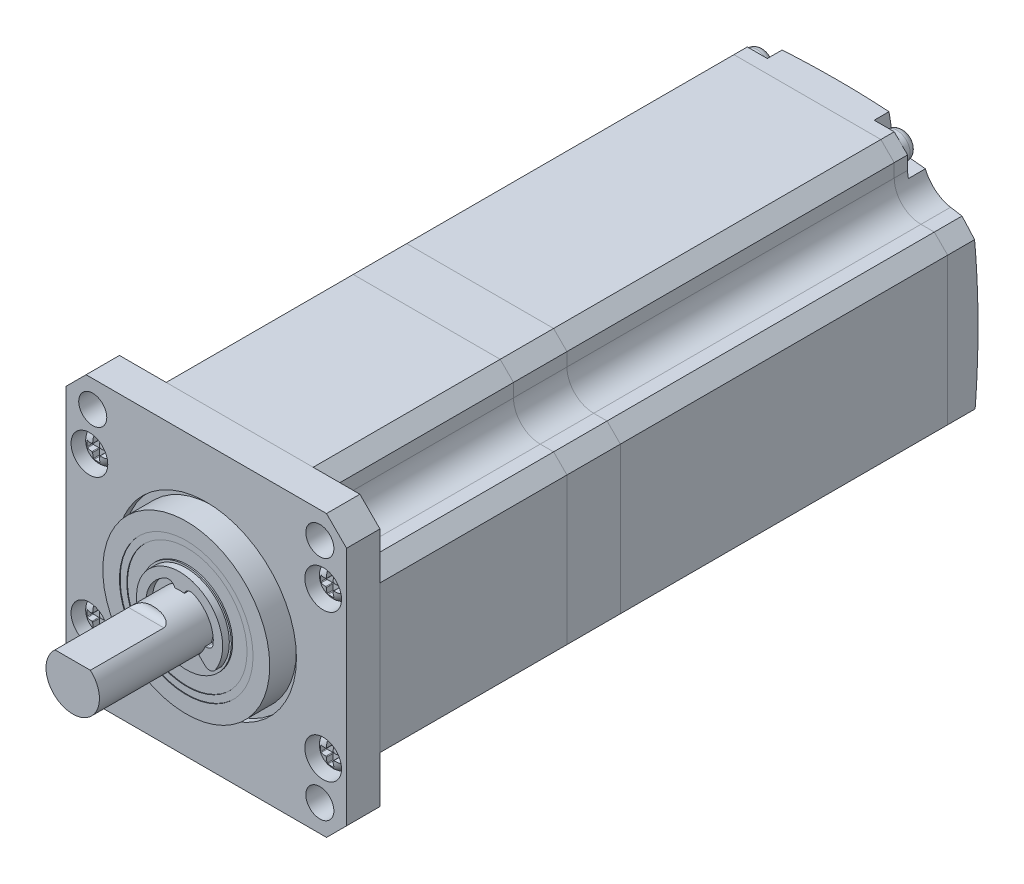
from build123d import *

# Parameters (mm, degrees)
SKETCH_1_R          = 2.1
EXTRUDE_1_DEPTH     = 5
SKETCH_2_R          = 12.5
SKETCH_2_R_2        = 4
EXTRUDE_2_DEPTH     = 3
SKETCH_2_3_R        = 4
EXTRUDE_3_DEPTH     = 20
CUT_EXTRUDE_START   = -1
SKETCH_2_4_R        = 13.5
SKETCH_2_4_R_2      = 12.5
CUT_EXTRUDE_1_DEPTH = 1
CUT_EXTRUDE_2_DEPTH = 12
FILLET_1_R          = 1
SKETCH_5_R          = 10
SKETCH_5_R_2        = 9
CUT_EXTRUDE_3_DEPTH = 0.1
SKETCH_5_4_R        = 9
SKETCH_5_4_R_2      = 6.75
CUT_EXTRUDE_4_DEPTH = 0.2
EXTRUDE_4_DEPTH     = 90
EXTRUDE_5_DEPTH     = 1
FILLET_2_R          = 1
SKETCH_8_R          = 2.75
CUT_EXTRUDE_5_DEPTH = 3
SKETCH_9_R          = 2.5
EXTRUDE_6_DEPTH     = 2
CUT_EXTRUDE_6_DEPTH = 1
FILLET_3_R          = 1.6
FILLET_4_R          = 0.1
CUT_EXTRUDE_7_DEPTH = 3
SKETCH_16_R         = 2
EXTRUDE_7_DEPTH     = 2
CUT_EXTRUDE_8_DEPTH = 1
FILLET_5_R          = 1.1


# Some blends are built 0.0001 mm under size
with BuildPart() as part:
    # 草圖1 → 填料-伸長1 (new body)
    with BuildSketch(Plane.XY):
        Polygon((39, -42), (3, -42), (0, -39), (0, -3), (3, 0), (39, 0), (42, -3), (42, -39), align=None)
        with Locations((4, -4)):
            Circle(SKETCH_1_R, mode=Mode.SUBTRACT)
        with Locations((38, -4)):
            Circle(SKETCH_1_R, mode=Mode.SUBTRACT)
        with Locations((4, -38)):
            Circle(SKETCH_1_R, mode=Mode.SUBTRACT)
        with Locations((38, -38)):
            Circle(SKETCH_1_R, mode=Mode.SUBTRACT)
    extrude(amount=EXTRUDE_1_DEPTH)

    # 草圖2 → 填料-伸長2 (add)
    # profile 1 of 2: a face of its own
    with BuildSketch(Plane.XY.offset(5)):
        with Locations((21, -21)):
            Circle(SKETCH_2_R)
        with Locations((21, -21)):
            Circle(SKETCH_2_R_2, mode=Mode.SUBTRACT)
    # profile 2 of 2: a face of its own
    with BuildSketch(Plane.XY.offset(5)):
        with Locations((21, -21)):
            Circle(SKETCH_2_R_2)
    extrude(amount=EXTRUDE_2_DEPTH)

    # 草圖2<3> → 填料-伸長3 (add)
    with BuildSketch(Plane.XY.offset(5)):
        with Locations((21, -21)):
            Circle(SKETCH_2_3_R)
    extrude(amount=EXTRUDE_3_DEPTH)

    # 草圖2<4> → 除料-伸長1 (cut)
    with BuildSketch(Plane.XY.offset(5).offset(CUT_EXTRUDE_START)):
        with Locations((21, -21)):
            Circle(SKETCH_2_4_R)
        with Locations((21, -21)):
            Circle(SKETCH_2_4_R_2, mode=Mode.SUBTRACT)
    extrude(amount=CUT_EXTRUDE_1_DEPTH, mode=Mode.SUBTRACT)

    # 草圖3 → 除料-伸長2 (cut)
    with BuildSketch(Plane.XY.offset(25)):
        Polygon((-59.028881398, -18), (18.354248689, -18), (23.645751311, -18), (101.028881398, -18), (101.028881398, 136.766260173), (-59.028881398, 136.766260173), align=None)
    extrude(amount=-CUT_EXTRUDE_2_DEPTH, mode=Mode.SUBTRACT)

    # 圓角1
    fillet_1_edges = [part.edges().sort_by_distance(p)[0] for p in [
        (21, -18, 13),
    ]]
    fillet(fillet_1_edges, radius=FILLET_1_R - 0.0001)  # a hair under: the kernel refuses the full size

    # 草圖5 → 除料-伸長3 (cut)
    with BuildSketch(Plane.XY.offset(8)):
        with Locations((21, -21)):
            Circle(SKETCH_5_R)
        with Locations((21, -21)):
            Circle(SKETCH_5_R_2, mode=Mode.SUBTRACT)
    extrude(amount=-CUT_EXTRUDE_3_DEPTH, mode=Mode.SUBTRACT)

    # 草圖5<4> → 除料-伸長4 (cut)
    with BuildSketch(Plane.XY.offset(8)):
        with Locations((21, -21)):
            Circle(SKETCH_5_4_R)
        with Locations((21, -21)):
            Circle(SKETCH_5_4_R_2, mode=Mode.SUBTRACT)
    extrude(amount=-CUT_EXTRUDE_4_DEPTH, mode=Mode.SUBTRACT)

    # 草圖6 → 填料-伸長4 (add)
    with BuildSketch(Plane(origin=(0, 0, 0), x_dir=(-1, 0, 0), z_dir=(0, 0, -1))):
        with BuildLine():
            Line((-34, -2), (-32, 0))
            Line((-32, 0), (-10, 0))
            Line((-10, 0), (-8, -2))
            Line((-8, -2), (-8, -4))
            ThreePointArc((-8, -4), (-6.828427125, -6.828427125), (-4, -8))
            Line((-4, -8), (-2, -8))
            Line((-2, -8), (0, -10))
            Line((0, -10), (0, -32))
            Line((0, -32), (-2, -34))
            Line((-2, -34), (-4, -34))
            ThreePointArc((-4, -34), (-6.828427125, -35.171572875), (-8, -38))
            Line((-8, -38), (-8, -40))
            Line((-8, -40), (-10, -42))
            Line((-10, -42), (-32, -42))
            Line((-32, -42), (-34, -40))
            Line((-34, -40), (-34, -38))
            ThreePointArc((-34, -38), (-35.171572875, -35.171572875), (-38, -34))
            Line((-38, -34), (-40, -34))
            Line((-40, -34), (-42, -32))
            Line((-42, -32), (-42, -10))
            Line((-42, -10), (-40, -8))
            Line((-40, -8), (-38, -8))
            ThreePointArc((-38, -8), (-35.171572875, -6.828427125), (-34, -4))
            Line((-34, -4), (-34, -2))
        make_face()
    extrude(amount=EXTRUDE_4_DEPTH)

    # 草圖7 → 填料-伸長5 (add)
    with BuildSketch(Plane.XY.offset(8)):
        with BuildLine():
            Line((16.439161261, -25.560838739), (18.136217536, -23.863782464))
            ThreePointArc((18.136217536, -23.863782464), (17.566814434, -23.148426603), (17.172383736, -22.323576116))
            Line((17.172383736, -22.323576116), (16.126536523, -22.323576116))
            ThreePointArc((16.126536523, -22.323576116), (16.736277028, -18.293865041), (20.123076703, -16.026720847))
            Line((20.123076703, -16.026720847), (20.29672488, -17.0115286))
            ThreePointArc((20.29672488, -17.0115286), (21, -16.95), (21.70327512, -17.0115286))
            Line((21.70327512, -17.0115286), (21.876923297, -16.026720847))
            ThreePointArc((21.876923297, -16.026720847), (25.264712589, -18.295424888), (25.872493847, -22.327141179))
            Line((25.872493847, -22.327141179), (24.826381618, -22.327141179))
            ThreePointArc((24.826381618, -22.327141179), (24.432184504, -23.150025472), (23.863782464, -23.863782464))
            Line((23.863782464, -23.863782464), (25.560838739, -25.560838739))
            ThreePointArc((25.560838739, -25.560838739), (21, -14.55), (16.439161261, -25.560838739))
        make_face()
    extrude(amount=EXTRUDE_5_DEPTH)

    # 圓角2
    # the kernel refuses this fillet: 1 mm, written as the material it adds along each edge
    with BuildSketch(Plane(origin=(20.123076703, -16.026720847, 4.882716049), x_dir=(-0.9558358766981501, -0.29390096430035584, 0), z_dir=(0, 0, 1))) as fillet_2_piece_1:
        with BuildLine():
            CenterArc((1.12345679, 0.992349949), FILLET_2_R, 180, 97.091646084)
            Line((0.12345679, 0.992349949), (0, 0))
            ThreePointArc((0, 0), (0.62345679, -0.038632758), (1.24691358, 0))
        make_face()
    extrude(amount=4.117283951)
    with BuildSketch(Plane(origin=(21.876923297, -16.026720847, 4.882716049), x_dir=(-0.1736481776669265, -0.9848077530122088, 0), z_dir=(0, 0, 1))) as fillet_2_piece_2:
        with BuildLine():
            CenterArc((1.12345679, 0.992349949), FILLET_2_R, 165.816707831, 97.091646084)
            ThreePointArc((0.153939948, 1.237374628), (0.038632758, 0.62345679), (0, 0))
            Line((0, 0), (1, 0))
        make_face()
    extrude(amount=4.117283951)
    with BuildSketch(Plane(origin=(25.872493847, -22.327141179, 5.666954924), x_dir=(0.17252595319935563, 0.9850049723085937, 0), z_dir=(0, 0, 1))) as fillet_2_piece_3:
        with BuildLine():
            CenterArc((0.840820206, 0.995722171), FILLET_2_R, 189.934715907, 85.36685138)
            Line((-0.144184767, 0.823196218), (0, 0))
            ThreePointArc((0, 0), (0.466609015, -0.021603036), (0.93321803, 0))
        make_face()
    extrude(amount=3.333045076)
    with BuildSketch(Plane(origin=(16.126536523, -22.323576116, 5.665050192), x_dir=(1, 0, 0), z_dir=(0, 0, 1))) as fillet_2_piece_4:
        with BuildLine():
            CenterArc((0.836410283, 1), FILLET_2_R, 184.582549745, 85.417450255)
            ThreePointArc((-0.160392975, 0.920104663), (-0.101513427, 0.456336355), (0, 0))
            Line((0, 0), (0.836410283, 0))
        make_face()
    extrude(amount=3.334949808)
    # the kernel refuses this fillet: 1 mm, written as the material it takes off along each edge
    with BuildSketch(Plane(origin=(25.560838739, -25.560838739, 8), x_dir=(-0.7071067811865458, 0.7071067811865491, 0), z_dir=(0, 0, 1))) as fillet_2_2_piece_1:
        with BuildLine():
            CenterArc((1.092528582, -1), FILLET_2_R, 90, 100.57288959)
            ThreePointArc((0.109506303, -1.183486239), (0.027434923, -0.594270836), (0, 0))
            Line((0, 0), (1.092528582, 0))
        make_face()
    extrude(amount=3.971354181, mode=Mode.SUBTRACT)
    with BuildSketch(Plane(origin=(16.439161261, -25.560838739, 8), x_dir=(0.707106781186541, 0.707106781186554, 0), z_dir=(0, 0, 1))) as fillet_2_2_piece_2:
        with BuildLine():
            CenterArc((1.092528582, 1), FILLET_2_R, 169.42711041, 100.57288959)
            ThreePointArc((0.109506303, 1.183486239), (0.027434923, 0.594270836), (0, 0))
            Line((0, 0), (1.092528582, 0))
        make_face()
    extrude(amount=3.971354181, mode=Mode.SUBTRACT)

    # 草圖8 → 除料-伸長5 (cut)
    with BuildSketch(Plane.XY.offset(5)):
        with Locations((3.5, -10)):
            Circle(SKETCH_8_R)
        with Locations((38.5, -10)):
            Circle(SKETCH_8_R)
        with Locations((3.5, -32)):
            Circle(SKETCH_8_R)
        with Locations((38.5, -32)):
            Circle(SKETCH_8_R)
    extrude(amount=-CUT_EXTRUDE_5_DEPTH, mode=Mode.SUBTRACT)

    # 草圖9 → 填料-伸長6 (add)
    with BuildSketch(Plane.XY.offset(2)):
        with Locations((3.5, -10)):
            Circle(SKETCH_9_R)
        with Locations(Location((38.5, -10, 0), (0, 0, 180))):
            Circle(SKETCH_9_R)
        with Locations((38.5, -32)):
            Circle(SKETCH_9_R)
        with Locations(Location((3.5, -32, 0), (0, 0, 180))):
            Circle(SKETCH_9_R)
    extrude(amount=EXTRUDE_6_DEPTH)

    # 草圖10 → 除料-伸長6 (cut)
    with BuildSketch(Plane.XY.offset(4)):
        Polygon((2, -10.5), (3, -10.5), (3, -11.5), (4, -11.5), (4, -10.5), (5, -10.5), (5, -9.5), (4, -9.5), (4, -8.5), (3, -8.5), (3, -9.5), (2, -9.5), align=None)
        Polygon((38, -9.5), (37, -9.5), (37, -10.5), (38, -10.5), (38, -11.5), (39, -11.5), (39, -10.5), (40, -10.5), (40, -9.5), (39, -9.5), (39, -8.5), (38, -8.5), align=None)
        Polygon((38, -32.5), (38, -33.5), (39, -33.5), (39, -32.5), (40, -32.5), (40, -31.5), (39, -31.5), (39, -30.5), (38, -30.5), (38, -31.5), (37, -31.5), (37, -32.5), align=None)
        Polygon((4, -32.5), (5, -32.5), (5, -31.5), (4, -31.5), (4, -30.5), (3, -30.5), (3, -31.5), (2, -31.5), (2, -32.5), (3, -32.5), (3, -33.5), (4, -33.5), align=None)
    extrude(amount=-CUT_EXTRUDE_6_DEPTH, mode=Mode.SUBTRACT)

    # 圓角3
    # the kernel refuses this fillet: 1.6 mm, written as the material it takes off along each edge
    with BuildSketch(Plane(origin=(3.5, -10, 4), x_dir=(1, 0, 0), z_dir=(0, -1, 0))) as fillet_3_piece_1:
        with BuildLine():
            CenterArc((2.5 - FILLET_3_R, -FILLET_3_R), FILLET_3_R, 0, 90)
            Line((2.5 - FILLET_3_R, 0), (2.5, 0))
            Line((2.5, 0), (2.5, -FILLET_3_R))
        make_face()
    revolve(axis=Axis((3.5, -10, 4), (0, 0, 1)), mode=Mode.SUBTRACT)
    with BuildSketch(Plane(origin=(38.5, -32, 4), x_dir=(1, 0, 0), z_dir=(0, -1, 0))) as fillet_3_piece_2:
        with BuildLine():
            CenterArc((2.5 - FILLET_3_R, -FILLET_3_R), FILLET_3_R, 0, 90)
            Line((2.5 - FILLET_3_R, 0), (2.5, 0))
            Line((2.5, 0), (2.5, -FILLET_3_R))
        make_face()
    revolve(axis=Axis((38.5, -32, 4), (0, 0, 1)), mode=Mode.SUBTRACT)
    with BuildSketch(Plane(origin=(3.5, -32, 4), x_dir=(-1, 0, 0), z_dir=(0, 1, 0))) as fillet_3_piece_3:
        with BuildLine():
            CenterArc((2.5 - FILLET_3_R, -FILLET_3_R), FILLET_3_R, 0, 90)
            Line((2.5 - FILLET_3_R, 0), (2.5, 0))
            Line((2.5, 0), (2.5, -FILLET_3_R))
        make_face()
    revolve(axis=Axis((3.5, -32, 4), (0, 0, 1)), mode=Mode.SUBTRACT)
    with BuildSketch(Plane(origin=(38.5, -10, 4), x_dir=(-1, 0, 0), z_dir=(0, 1, 0))) as fillet_3_piece_4:
        with BuildLine():
            CenterArc((2.5 - FILLET_3_R, -FILLET_3_R), FILLET_3_R, 0, 90)
            Line((2.5 - FILLET_3_R, 0), (2.5, 0))
            Line((2.5, 0), (2.5, -FILLET_3_R))
        make_face()
    revolve(axis=Axis((38.5, -10, 4), (0, 0, 1)), mode=Mode.SUBTRACT)

    # 圓角4
    fillet_4_edges = [part.edges().sort_by_distance(p)[0] for p in [
        (3, -11.5, 3.423887059),
        (4, -11.5, 3.423887059),
        (3, -10.5, 3.5),
        (2, -10.5, 3.423887059),
        (2, -9.5, 3.423887059),
        (3, -9.5, 3.5),
        (4, -10.5, 3.5),
        (5, -10.5, 3.423887059),
        (5, -9.5, 3.423887059),
        (4, -9.5, 3.5),
        (4, -8.5, 3.423887059),
        (3, -8.5, 3.423887059),
        (40, -32.5, 3.423887059),
        (40, -31.5, 3.423887059),
        (39, -31.5, 3.5),
        (39, -30.5, 3.423887059),
        (38, -30.5, 3.423887059),
        (38, -31.5, 3.5),
        (37, -31.5, 3.423887059),
        (37, -32.5, 3.423887059),
        (38, -32.5, 3.5),
        (38, -33.5, 3.423887059),
        (39, -33.5, 3.423887059),
        (39, -32.5, 3.5),
        (39, -11.5, 3.423887059),
        (38, -11.5, 3.423887059),
        (39, -10.5, 3.5),
        (40, -10.5, 3.423887059),
        (40, -9.5, 3.423887059),
        (39, -9.5, 3.5),
        (39, -8.5, 3.423887059),
        (38, -8.5, 3.423887059),
        (38, -9.5, 3.5),
        (37, -9.5, 3.423887059),
        (37, -10.5, 3.423887059),
        (38, -10.5, 3.5),
        (4, -33.5, 3.423887059),
        (3, -33.5, 3.423887059),
        (2, -32.5, 3.423887059),
        (3, -32.5, 3.5),
        (4, -32.5, 3.5),
        (5, -32.5, 3.423887059),
        (5, -31.5, 3.423887059),
        (4, -31.5, 3.5),
        (4, -30.5, 3.423887059),
        (3, -30.5, 3.423887059),
        (3, -31.5, 3.5),
        (2, -31.5, 3.423887059),
    ]]
    fillet(fillet_4_edges, radius=FILLET_4_R)

    # 草圖11 → 除料-伸長7 (cut)
    with BuildSketch(Plane(origin=(0, 0, -90), x_dir=(-1, 0, 0), z_dir=(0, 0, -1))):
        with BuildLine():
            Line((-29, -2.5), (-29, 0))
            Line((-29, 0), (-32, 0))
            Line((-32, 0), (-34, -2))
            Line((-34, -2), (-34, -4))
            Line((-34, -4), (-34.127016654, -5))
            Line((-34.127016654, -5), (-31.5, -5))
            ThreePointArc((-31.5, -5), (-29.732233047, -4.267766953), (-29, -2.5))
        make_face()
        with BuildLine():
            Line((-10.5, -5), (-7.872983346, -5))
            Line((-7.872983346, -5), (-8, -4))
            Line((-8, -4), (-8, -2))
            Line((-8, -2), (-10, 0))
            Line((-10, 0), (-13, 0))
            Line((-13, 0), (-13, -2.5))
            ThreePointArc((-13, -2.5), (-12.267766953, -4.267766953), (-10.5, -5))
        make_face()
        with BuildLine():
            Line((-10.5, -37), (-7.872983346, -37))
            Line((-7.872983346, -37), (-8, -38))
            Line((-8, -38), (-8, -40))
            Line((-8, -40), (-10, -42))
            Line((-10, -42), (-13, -42))
            Line((-13, -42), (-13, -39.5))
            ThreePointArc((-13, -39.5), (-12.267766953, -37.732233047), (-10.5, -37))
        make_face()
        with BuildLine():
            Line((-31.5, -37), (-34.127016654, -37))
            Line((-34.127016654, -37), (-34, -38))
            Line((-34, -38), (-34, -40))
            Line((-34, -40), (-32, -42))
            Line((-32, -42), (-29, -42))
            Line((-29, -42), (-29, -39.5))
            ThreePointArc((-29, -39.5), (-29.732233047, -37.732233047), (-31.5, -37))
        make_face()
    extrude(amount=-CUT_EXTRUDE_7_DEPTH, mode=Mode.SUBTRACT)

    # 草圖13 → 除料-旋轉2 (revolve, cut)
    with BuildSketch(Plane(origin=(21, 0, 0), x_dir=(0, 0, -1), z_dir=(1, 0, 0)), mode=Mode.PRIVATE) as cut_revolve_2_sk:
        with BuildLine():
            Line((90.461484423, -7.204229177), (90.461484423, 3.854902954))
            Line((90.461484423, 3.854902954), (88.758047769, 3.854902954))
            ThreePointArc((88.758047769, 3.854902954), (89.728570569, -1.656363674), (90.461484423, -7.204229177))
        make_face()
    revolve(cut_revolve_2_sk.sketch.rotate(Axis((21, -21.486453683, -93.402534189), (0, 0, 1)), 20.421688273), axis=Axis((21, -21.486453683, -93.402534189), (0, 0, 1)), mode=Mode.SUBTRACT)

    # 草圖16 → 填料-伸長7 (add)
    with BuildSketch(Plane(origin=(0, 0, -87), x_dir=(-1, 0, 0), z_dir=(0, 0, -1))):
        with Locations((-31.5, -2.5)):
            Circle(SKETCH_16_R)
        with Locations(Location((-10.5, -2.5, 0), (0, 0, 180))):
            Circle(SKETCH_16_R)
        with Locations((-10.5, -39.5)):
            Circle(SKETCH_16_R)
        with Locations(Location((-31.5, -39.5, 0), (0, 0, 180))):
            Circle(SKETCH_16_R)
    extrude(amount=EXTRUDE_7_DEPTH)

    # 草圖17 → 除料-伸長8 (cut)
    with BuildSketch(Plane(origin=(0, 0, -89), x_dir=(-1, 0, 0), z_dir=(0, 0, -1))):
        Polygon((-33.001872774, -2.962300906), (-32.001874774, -2.962300906), (-32.001874774, -3.962300906), (-31.001870774, -3.962300906), (-31.001870774, -2.962300906), (-30.001870774, -2.962300906), (-30.001870774, -1.962300906), (-31.001870774, -1.962300906), (-31.001870774, -0.962300906), (-32.001874774, -0.962300906), (-32.001874774, -1.962300906), (-33.001872774, -1.962300906), align=None)
        Polygon((-8.998127226, -2.962300906), (-8.998127226, -1.962300906), (-9.998125226, -1.962300906), (-9.998125226, -0.962300906), (-10.998129226, -0.962300906), (-10.998129226, -1.962300906), (-11.998129226, -1.962300906), (-11.998129226, -2.962300906), (-10.998129226, -2.962300906), (-10.998129226, -3.962300906), (-9.998125226, -3.962300906), (-9.998125226, -2.962300906), align=None)
        Polygon((-8.998127226, -39.037699094), (-9.998125226, -39.037699094), (-9.998125226, -38.037699094), (-10.998129226, -38.037699094), (-10.998129226, -39.037699094), (-11.998129226, -39.037699094), (-11.998129226, -40.037699094), (-10.998129226, -40.037699094), (-10.998129226, -41.037699094), (-9.998125226, -41.037699094), (-9.998125226, -40.037699094), (-8.998127226, -40.037699094), align=None)
        Polygon((-33.001872774, -39.037699094), (-33.001872774, -40.037699094), (-32.001874774, -40.037699094), (-32.001874774, -41.037699094), (-31.001870774, -41.037699094), (-31.001870774, -40.037699094), (-30.001870774, -40.037699094), (-30.001870774, -39.037699094), (-31.001870774, -39.037699094), (-31.001870774, -38.037699094), (-32.001874774, -38.037699094), (-32.001874774, -39.037699094), align=None)
    extrude(amount=-CUT_EXTRUDE_8_DEPTH, mode=Mode.SUBTRACT)

    # 圓角5
    # the kernel refuses this fillet: 1.1 mm, written as the material it takes off along each edge
    with BuildSketch(Plane(origin=(31.5, -39.5, -89), x_dir=(1, 0, 0), z_dir=(0, 1, 0))) as fillet_5_piece_1:
        with BuildLine():
            CenterArc((2 - FILLET_5_R, -FILLET_5_R), FILLET_5_R, 0, 90)
            Line((2 - FILLET_5_R, 0), (2, 0))
            Line((2, 0), (2, -FILLET_5_R))
        make_face()
    revolve(axis=Axis((31.5, -39.5, -89), (0, 0, -1)), mode=Mode.SUBTRACT)
    with BuildSketch(Plane(origin=(10.5, -39.5, -89), x_dir=(-1, 0, 0), z_dir=(0, -1, 0))) as fillet_5_piece_2:
        with BuildLine():
            CenterArc((2 - FILLET_5_R, -FILLET_5_R), FILLET_5_R, 0, 90)
            Line((2 - FILLET_5_R, 0), (2, 0))
            Line((2, 0), (2, -FILLET_5_R))
        make_face()
    revolve(axis=Axis((10.5, -39.5, -89), (0, 0, -1)), mode=Mode.SUBTRACT)
    with BuildSketch(Plane(origin=(31.5, -2.5, -89), x_dir=(-1, 0, 0), z_dir=(0, -1, 0))) as fillet_5_piece_3:
        with BuildLine():
            CenterArc((2 - FILLET_5_R, -FILLET_5_R), FILLET_5_R, 0, 90)
            Line((2 - FILLET_5_R, 0), (2, 0))
            Line((2, 0), (2, -FILLET_5_R))
        make_face()
    revolve(axis=Axis((31.5, -2.5, -89), (0, 0, -1)), mode=Mode.SUBTRACT)
    with BuildSketch(Plane(origin=(10.5, -2.5, -89), x_dir=(1, 0, 0), z_dir=(0, 1, 0))) as fillet_5_piece_4:
        with BuildLine():
            CenterArc((2 - FILLET_5_R, -FILLET_5_R), FILLET_5_R, 0, 90)
            Line((2 - FILLET_5_R, 0), (2, 0))
            Line((2, 0), (2, -FILLET_5_R))
        make_face()
    revolve(axis=Axis((10.5, -2.5, -89), (0, 0, -1)), mode=Mode.SUBTRACT)


with BuildPart() as body_2:
    # Split Bodies 3: the piece on the far side of the plane
    add(part.part)
    split(bisect_by=Plane(origin=(0, 0, 0), x_dir=(-1, 0, 0), z_dir=(0, 0, -1)), keep=Keep.BOTTOM)


with BuildPart() as part_1:
    add(part.part)

    # Split Bodies 3
    split(bisect_by=Plane(origin=(0, 0, 0), x_dir=(-1, 0, 0), z_dir=(0, 0, -1)), keep=Keep.TOP)


with BuildPart() as body_3:
    # Split Bodies 4: the piece on the far side of the plane
    add(part_1.part)
    split(bisect_by=Plane(origin=(0, 0, -28), x_dir=(-1, 0, 0), z_dir=(0, 0, -1)), keep=Keep.BOTTOM)


with BuildPart() as part_2:
    add(part_1.part)

    # Split Bodies 4
    split(bisect_by=Plane(origin=(0, 0, -28), x_dir=(-1, 0, 0), z_dir=(0, 0, -1)), keep=Keep.TOP)


with BuildPart() as body_4:
    # Split Bodies 5: the piece on the far side of the plane
    add(part_2.part)
    split(bisect_by=Plane(origin=(0, 0, -36), x_dir=(-1, 0, 0), z_dir=(0, 0, -1)), keep=Keep.BOTTOM)


with BuildPart() as part_3:
    add(part_2.part)

    # Split Bodies 5
    split(bisect_by=Plane(origin=(0, 0, -36), x_dir=(-1, 0, 0), z_dir=(0, 0, -1)), keep=Keep.TOP)


with BuildPart() as body_5:
    # Split Bodies 6: the piece on the far side of the plane
    add(part_3.part)
    split(bisect_by=Plane(origin=(0, 0, -85), x_dir=(-1, 0, 0), z_dir=(0, 0, -1)), keep=Keep.BOTTOM)


with BuildPart() as part_4:
    add(part_3.part)

    # Split Bodies 6
    split(bisect_by=Plane(origin=(0, 0, -85), x_dir=(-1, 0, 0), z_dir=(0, 0, -1)), keep=Keep.TOP)


solid = Compound([body_2.part, body_3.part, body_4.part, body_5.part, part_4.part])
